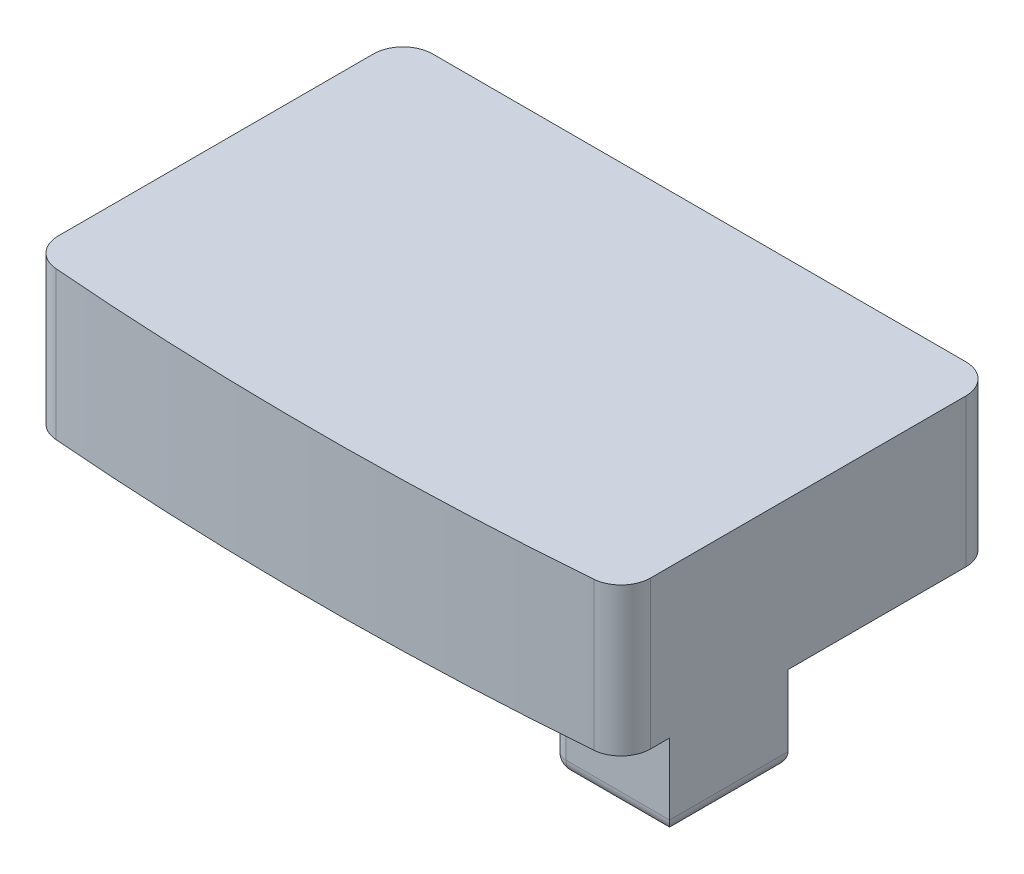
from build123d import *

# Parameters (mm, degrees)
BOSS_EXTRUDE1_DEPTH = 5
FILLET1_R           = 1
SKETCH2_R           = 0.7835
CUT_EXTRUDE1_DEPTH  = 4
SKETCH3_W           = 4
SKETCH3_H           = 2.9
BOSS_EXTRUDE2_DEPTH = 4
FILLET2_R           = 0.5


with BuildPart() as part:
    # Sketch1 → Boss-Extrude1 (new body)
    with BuildSketch(Plane(origin=(0, 0, 0), x_dir=(1, 0, 0), z_dir=(0, 1, 0))):
        with BuildLine():
            Line((0.5, 0.439443467), (0.5, 13))
            Line((0.5, 13), (20.5, 13))
            Line((20.5, 13), (20.5, 0.439443467))
            ThreePointArc((20.5, 0.439443467), (10.5, 0), (0.5, 0.439443467))
        make_face()
    extrude(amount=BOSS_EXTRUDE1_DEPTH)

    # Fillet1
    fillet1_edges = [part.edges().sort_by_distance(p)[0] for p in [
        (20.5, 2.5, -13),
        (0.5, 2.5, -13),
        (20.5, 2.5, -0.439443467),
        (0.5, 2.5, -0.439443467),
    ]]
    fillet(fillet1_edges, radius=FILLET1_R)

    # Sketch2 → Cut-Extrude1 (cut)
    with BuildSketch(Plane.XZ):
        with Locations((5.5, -10)):
            Circle(SKETCH2_R)
        with Locations((15.5, -10)):
            Circle(SKETCH2_R)
    extrude(amount=-CUT_EXTRUDE1_DEPTH, mode=Mode.SUBTRACT)

    # Sketch3 → Boss-Extrude2 (add)
    with BuildSketch(Plane(origin=(20.5, 0, 0), x_dir=(0, 0, -1), z_dir=(1, 0, 0))):
        with Locations((4, -1.45)):
            Rectangle(SKETCH3_W, SKETCH3_H)
    extrude(amount=-BOSS_EXTRUDE2_DEPTH)

    # Fillet2
    fillet2_edges = [part.edges().sort_by_distance(p)[0] for p in [
        (18.5, -2.9, -6),
        (16.5, -2.9, -4),
        (18.5, -2.9, -2),
        (20.5, -2.9, -4),
        (16.5, -1.45, -2),
        (16.5, -1.45, -6),
    ]]
    fillet(fillet2_edges, radius=FILLET2_R)


solid = part.part
